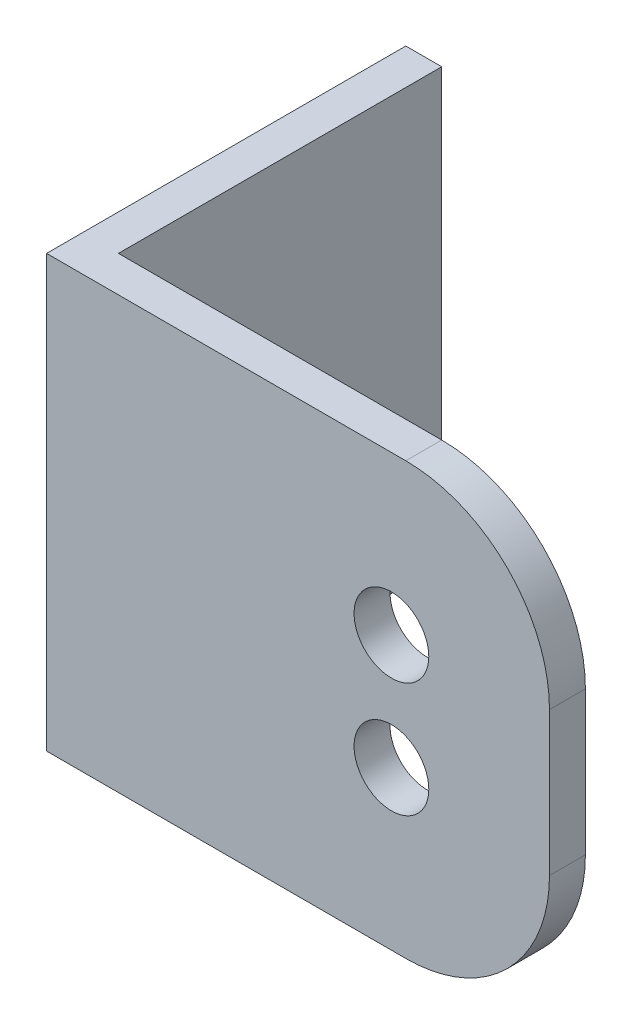
from build123d import *

# Parameters (mm, degrees)
SKETCH1_W               = 44.45
SKETCH1_H               = 38.1
BOSS_EXTRUDE1_DEPTH     = 3.175
CUT_EXTRUDE1_DEPTH      = 49.464271634
CUT_EXTRUDE1_DEPTH_BACK = 49.464271634
SKETCH2_R               = 3.302
SKETCH3_W               = 3.175
SKETCH3_H               = 38.1
BOSS_EXTRUDE2_DEPTH     = 28.575
FILLET1_R               = 12.7


with BuildPart() as part:
    # Sketch1 → Boss-Extrude1 (new body)
    with BuildSketch(Plane.XY):
        with Locations((22.225, 0)):
            Rectangle(SKETCH1_W, SKETCH1_H)
    extrude(amount=BOSS_EXTRUDE1_DEPTH)

    # Sketch2 → Cut-Extrude1 (cut, two sides: drawn at the far end of the back side and taken through both)
    with BuildSketch(Plane.XY.offset(3.175).offset(-CUT_EXTRUDE1_DEPTH_BACK)):
        with Locations((30.48, 5.08)):
            Circle(SKETCH2_R)
        with Locations((30.48, -5.08)):
            Circle(SKETCH2_R)
    extrude(amount=CUT_EXTRUDE1_DEPTH + CUT_EXTRUDE1_DEPTH_BACK, mode=Mode.SUBTRACT)

    # Sketch3 → Boss-Extrude2 (add)
    with BuildSketch(Plane(origin=(0, 0, 0), x_dir=(-1, 0, 0), z_dir=(0, 0, -1))):
        with Locations((-1.5875, 0)):
            Rectangle(SKETCH3_W, SKETCH3_H)
    extrude(amount=BOSS_EXTRUDE2_DEPTH)

    # Fillet1
    fillet1_edges = [part.edges().sort_by_distance(p)[0] for p in [
        (44.45, -19.05, 1.5875),
        (44.45, 19.05, 1.5875),
    ]]
    fillet(fillet1_edges, radius=FILLET1_R)


solid = part.part
